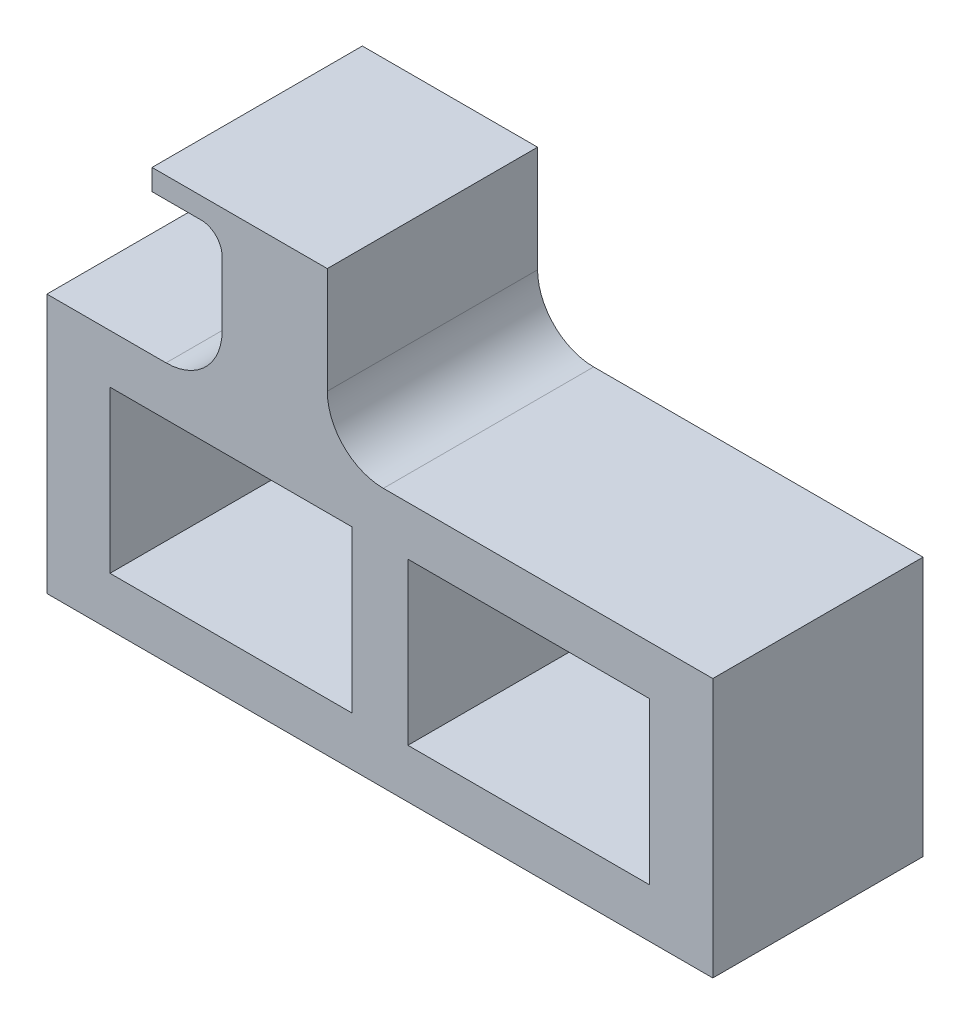
from build123d import *

# Parameters (mm, degrees)
SKETCH1_W           = 95
SKETCH1_H           = 30
BOSS_EXTRUDE1_DEPTH = 7
SKETCH2_W           = 9
SKETCH2_H           = 30
SKETCH2_W_2         = 8
BOSS_EXTRUDE2_DEPTH = 23
SKETCH3_W           = 95
SKETCH3_H           = 30
BOSS_EXTRUDE3_DEPTH = 7
SKETCH4_W           = 15
SKETCH4_H           = 30
BOSS_EXTRUDE4_DEPTH = 20.15
SKETCH5_W           = 25
SKETCH5_H           = 30
BOSS_EXTRUDE5_DEPTH = 3
FILLET2_R           = 3
FILLET3_R           = 8


with BuildPart() as part:
    # Sketch1 → Boss-Extrude1 (new body)
    with BuildSketch(Plane(origin=(0, 0, 0), x_dir=(1, 0, 0), z_dir=(0, 1, 0))):
        with Locations((47.5, 15)):
            Rectangle(SKETCH1_W, SKETCH1_H)
    extrude(amount=BOSS_EXTRUDE1_DEPTH)

    # Sketch2 → Boss-Extrude2 (add)
    with BuildSketch(Plane(origin=(0, 7, 0), x_dir=(1, 0, 0), z_dir=(0, 1, 0))):
        with Locations((4.5, 15)):
            Rectangle(SKETCH2_W, SKETCH2_H)
        with Locations((47.5, 15)):
            Rectangle(SKETCH2_W_2, SKETCH2_H)
        with Locations((90.5, 15)):
            Rectangle(SKETCH2_W, SKETCH2_H)
    extrude(amount=BOSS_EXTRUDE2_DEPTH)

    # Sketch3 → Boss-Extrude3 (add)
    with BuildSketch(Plane(origin=(0, 30, 0), x_dir=(1, 0, 0), z_dir=(0, 1, 0))):
        with Locations((47.5, 15)):
            Rectangle(SKETCH3_W, SKETCH3_H)
    extrude(amount=BOSS_EXTRUDE3_DEPTH)

    # Sketch4 → Boss-Extrude4 (add)
    with BuildSketch(Plane(origin=(0, 37, 0), x_dir=(1, 0, 0), z_dir=(0, 1, 0))):
        with Locations((32.5, 15)):
            Rectangle(SKETCH4_W, SKETCH4_H)
    extrude(amount=BOSS_EXTRUDE4_DEPTH)

    # Sketch5 → Boss-Extrude5 (add)
    with BuildSketch(Plane(origin=(0, 57.15, 0), x_dir=(1, 0, 0), z_dir=(0, 1, 0))):
        with Locations((27.5, 15)):
            Rectangle(SKETCH5_W, SKETCH5_H)
    extrude(amount=BOSS_EXTRUDE5_DEPTH)

    # Fillet2
    fillet2_edges = [part.edges().sort_by_distance(p)[0] for p in [
        (25, 57.15, -15),
    ]]
    fillet(fillet2_edges, radius=FILLET2_R)

    # Fillet3
    fillet3_edges = [part.edges().sort_by_distance(p)[0] for p in [
        (40, 37, -15),
        (25, 37, -15),
    ]]
    fillet(fillet3_edges, radius=FILLET3_R)


solid = part.part
